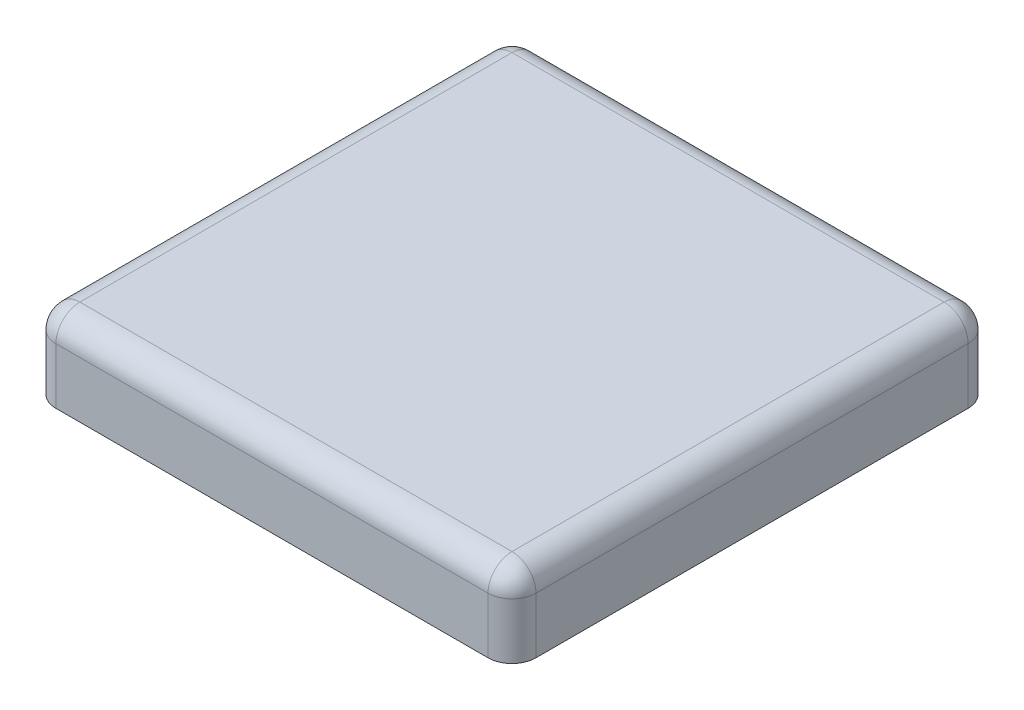
from build123d import *

# Parameters (mm, degrees)
SKETCH1_W           = 1524
SKETCH1_H           = 1524
BOSS_EXTRUDE1_DEPTH = 254
FILLET1_R           = 76.2
SHELL1_START        = -685.8
SHELL1_OUTLINE_W    = 177.8
SHELL1_OUTLINE_H    = 1371.6
SHELL1_DEPTH        = 1371.6
SCALE1_SCALE        = 0.02


# Read off the part's stored shape, not the designer's step: Shell1
with BuildPart() as part:
    # Sketch1 → Boss-Extrude1 (new body)
    with BuildSketch(Plane(origin=(0, 0, 0), x_dir=(1, 0, 0), z_dir=(0, 1, 0))):
        Rectangle(SKETCH1_W, SKETCH1_H)
    extrude(amount=BOSS_EXTRUDE1_DEPTH)

    # Fillet1
    fillet1_edges = [part.edges().sort_by_distance(p)[0] for p in [
        (-762, 254, 0),
        (0, 254, 762),
        (762, 254, 0),
        (762, 127, 762),
        (-762, 127, 762),
        (-762, 127, -762),
        (762, 127, -762),
        (0, 254, -762),
    ]]
    fillet(fillet1_edges, radius=FILLET1_R)

    # Shell1 outline → Shell1 (cut)
    with BuildSketch(Plane.YZ.offset(SHELL1_START)):
        with Locations((88.9, 0)):
            Rectangle(SHELL1_OUTLINE_W, SHELL1_OUTLINE_H)
    extrude(amount=SHELL1_DEPTH, mode=Mode.SUBTRACT)


with BuildPart() as part_1:
    # Scale1: scaled about (0, 175.373677195, 0)
    add(part.part.scale(SCALE1_SCALE).moved(Location((0, 171.866203651, 0))))


solid = part_1.part
